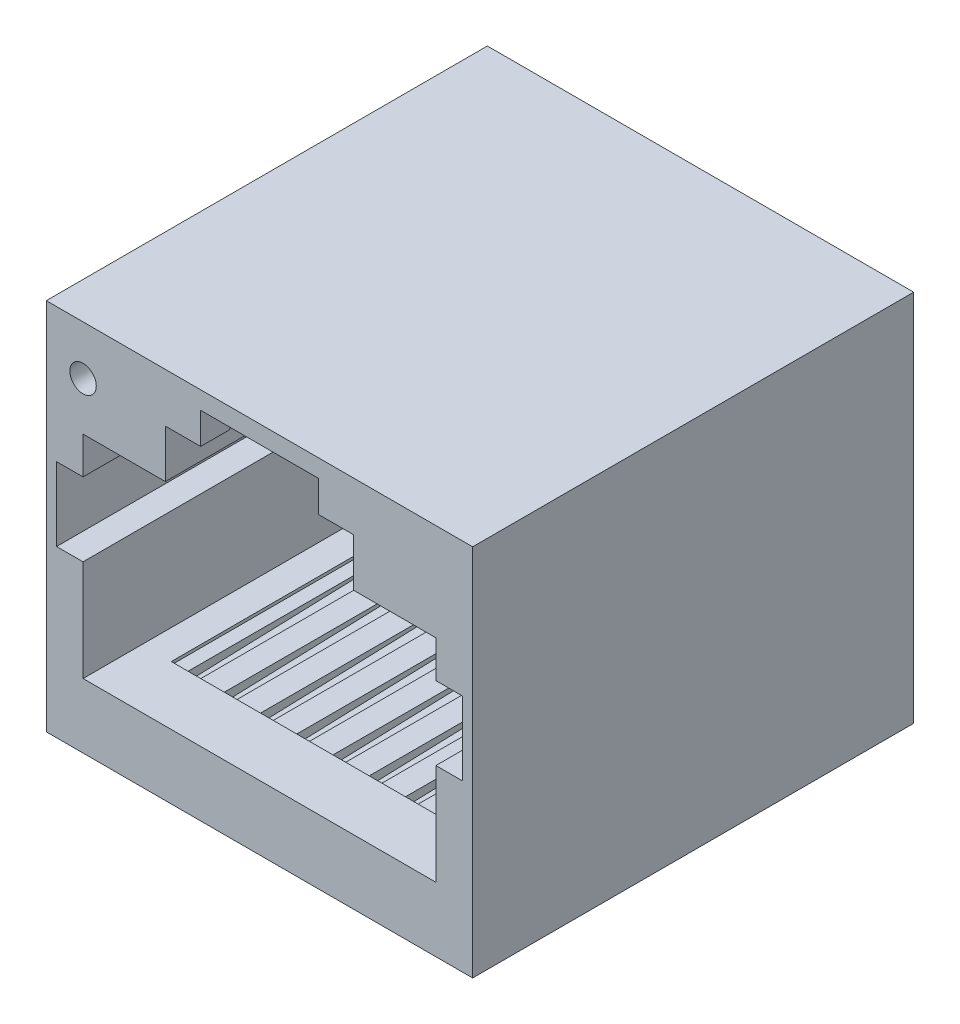
from build123d import *

# Parameters (mm, degrees)
SKETCH2_W               = 14.5
SKETCH2_H               = 15
OUTLINE_EXTRUSION_DEPTH = 12.7
CUT_EXTRUDE1_DEPTH      = 14
SKETCH5_R               = 0.45
CUT_EXTRUDE2_DEPTH      = 14
SKETCH6_W               = 4
SKETCH6_H               = 0.1
BOSS_EXTRUDE1_DEPTH     = 11.5
SKETCH7_W               = 1.2
SKETCH7_H               = 0.96471969
CUT_EXTRUDE3_DEPTH      = 13
BOSS_EXTRUDE2_DEPTH     = 2
SKETCH9_W               = 1.5
SKETCH9_H               = 2.5
CUT_EXTRUDE4_DEPTH      = 1.5
SKETCH10_W              = 0.301599202
SKETCH10_H              = 2.269304763
SKETCH10_W_2            = 0.301599203
CUT_EXTRUDE5_DEPTH      = 1.5
SKETCH12_W              = 10
SKETCH12_H              = 10
CUT_EXTRUDE6_DEPTH      = 0.1
SKETCH13_W              = 0.432318682
SKETCH13_H              = 9
CUT_EXTRUDE7_DEPTH      = 0.3
BOSS_EXTRUDE5_DEPTH     = 10


with BuildPart() as part:
    # Sketch2 → Outline extrusion (new body)
    with BuildSketch(Plane(origin=(0, 0, 0), x_dir=(1, 0, 0), z_dir=(0, 1, 0))):
        Rectangle(SKETCH2_W, SKETCH2_H)
    extrude(amount=OUTLINE_EXTRUSION_DEPTH)

    # Sketch3 → Cut-Extrude1 (cut)
    with BuildSketch(Plane.XY.offset(7.5)):
        Polygon((-3.2, 9.395210166), (-6, 9.395210166), (-6, 8.133168125), (-6.9, 8.133168125), (-6.9, 5.633168125), (-6, 5.633168125), (-6, 2.195210166), (6, 2.195210166), (6, 5.633168125), (6.9, 5.633168125), (6.9, 8.133168125), (6, 8.133168125), (6, 9.395210166), (3.2, 9.395210166), (3.2, 11.030490476), (2, 11.030490476), (2, 12.095210166), (-2, 12.095210166), (-2, 11.030490476), (-3.2, 11.030490476), align=None)
    extrude(amount=-CUT_EXTRUDE1_DEPTH, mode=Mode.SUBTRACT)

    # Sketch5 → Cut-Extrude2 (cut)
    with BuildSketch(Plane.XY.offset(7.5)):
        with Locations((-6, 11.030490476)):
            Circle(SKETCH5_R)
    extrude(amount=-CUT_EXTRUDE2_DEPTH, mode=Mode.SUBTRACT)

    # Sketch6 → Boss-Extrude1 (add)
    with BuildSketch(Plane.XY.offset(-6.5)):
        with Locations((0, 12.045210166)):
            Rectangle(SKETCH6_W, SKETCH6_H)
    extrude(amount=BOSS_EXTRUDE1_DEPTH)

    # Sketch7 → Cut-Extrude3 (cut)
    with BuildSketch(Plane.XY.offset(-6.5)):
        with Locations((-2.6, 11.512850321)):
            Rectangle(SKETCH7_W, SKETCH7_H)
        with Locations((2.6, 11.512850321)):
            Rectangle(SKETCH7_W, SKETCH7_H)
    extrude(amount=CUT_EXTRUDE3_DEPTH, mode=Mode.SUBTRACT)

    # Sketch8 → Boss-Extrude2 (add)
    with BuildSketch(Plane.XY.offset(-6.5)):
        Polygon((3.2, 9.395210166), (3.2, 10.695210166), (-3.2, 10.695210166), (-3.2, 9.395210166), (-6, 9.395210166), (-6, 8.133168125), (-6.9, 8.133168125), (-6.9, 5.633168125), (-6, 5.633168125), (-6, 2.195210166), (6, 2.195210166), (6, 5.633168125), (6.9, 5.633168125), (6.9, 8.133168125), (6, 8.133168125), (6, 9.395210166), align=None)
    extrude(amount=BOSS_EXTRUDE2_DEPTH)

    # Sketch9 → Cut-Extrude4 (cut)
    with BuildSketch(Plane.XY.offset(-4.5)):
        with Locations((-6.15, 6.883168125)):
            Rectangle(SKETCH9_W, SKETCH9_H)
        with Locations((6.15, 6.883168125)):
            Rectangle(SKETCH9_W, SKETCH9_H)
    extrude(amount=-CUT_EXTRUDE4_DEPTH, mode=Mode.SUBTRACT)

    # Sketch10 → Cut-Extrude5 (cut)
    with BuildSketch(Plane.XY.offset(-4.5)):
        with Locations((-3.855597209, 3.329862548)):
            Rectangle(SKETCH10_W, SKETCH10_H)
        with Locations((-2.753998006, 3.329862548)):
            Rectangle(SKETCH10_W_2, SKETCH10_H)
        with Locations((0.550799602, 3.329862548)):
            Rectangle(SKETCH10_W_2, SKETCH10_H)
        with Locations((-1.652398804, 3.329862548)):
            Rectangle(SKETCH10_W, SKETCH10_H)
        with Locations((-0.550799602, 3.329862548)):
            Rectangle(SKETCH10_W_2, SKETCH10_H)
        with Locations((1.652398804, 3.329862548)):
            Rectangle(SKETCH10_W, SKETCH10_H)
        with Locations((2.753998006, 3.329862548)):
            Rectangle(SKETCH10_W_2, SKETCH10_H)
        with Locations((3.855597209, 3.329862548)):
            Rectangle(SKETCH10_W, SKETCH10_H)
    extrude(amount=-CUT_EXTRUDE5_DEPTH, mode=Mode.SUBTRACT)

    # Sketch12 → Cut-Extrude6 (cut)
    with BuildSketch(Plane(origin=(0, 2.195210166, 0), x_dir=(1, 0, 0), z_dir=(0, 1, 0))):
        with Locations((0, -0.5)):
            Rectangle(SKETCH12_W, SKETCH12_H)
    extrude(amount=-CUT_EXTRUDE6_DEPTH, mode=Mode.SUBTRACT)

    # Sketch13 → Cut-Extrude7 (cut)
    with BuildSketch(Plane(origin=(0, 2.095210166, 0), x_dir=(1, 0, 0), z_dir=(0, 1, 0))):
        with Locations((-4.313115387, -1)):
            Rectangle(SKETCH13_W, SKETCH13_H)
        with Locations((-3.080796705, -1)):
            Rectangle(SKETCH13_W, SKETCH13_H)
        with Locations((-1.848478023, -1)):
            Rectangle(SKETCH13_W, SKETCH13_H)
        with Locations((-0.616159341, -1)):
            Rectangle(SKETCH13_W, SKETCH13_H)
        with Locations((0.616159341, -1)):
            Rectangle(SKETCH13_W, SKETCH13_H)
        with Locations((1.848478023, -1)):
            Rectangle(SKETCH13_W, SKETCH13_H)
        with Locations((3.080796705, -1)):
            Rectangle(SKETCH13_W, SKETCH13_H)
        with Locations((4.313115387, -1)):
            Rectangle(SKETCH13_W, SKETCH13_H)
    extrude(amount=-CUT_EXTRUDE7_DEPTH, mode=Mode.SUBTRACT)

    # Sketch14 → Boss-Extrude5 (add)
    with BuildSketch(Plane(origin=(-4.529274728, 0, 0), x_dir=(0, 0, -1), z_dir=(1, 0, 0))):
        Polygon((3.5, 2.095210166), (-5.5, 1.795210166), (3.5, 1.795210166), align=None)
    extrude(amount=BOSS_EXTRUDE5_DEPTH)


solid = part.part
